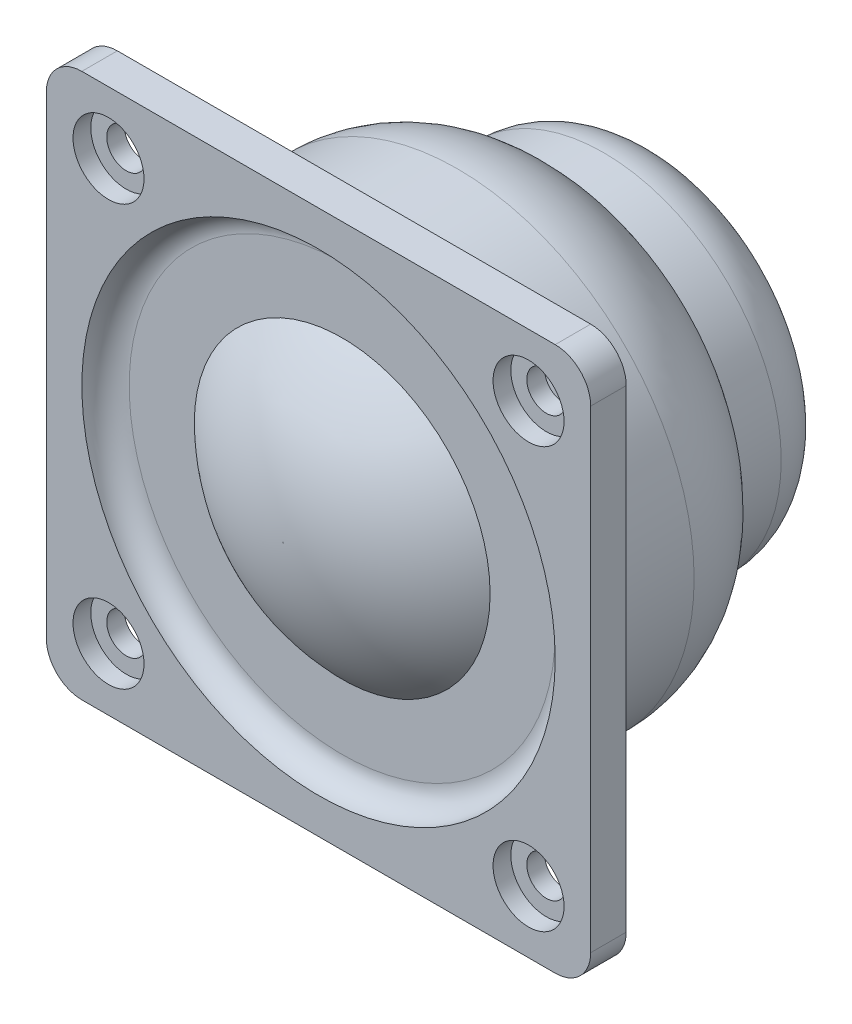
from build123d import *

# Parameters (mm, degrees)
ESQUISSE1_R             = 1.65
BOSS_EXTRU_1_DEPTH      = 3
ESQUISSE2_R             = 3
ENL_V_MAT_EXTRU_1_DEPTH = 1.5
ESQUISSE3_R             = 20
BOSS_EXTRU_2_DEPTH      = 17.4
ESQUISSE4_R             = 15
BOSS_EXTRU_3_DEPTH      = 8.7
CONG_1_R                = 10
CONG_2_R                = 5
ESQUISSE5_R             = 20
ENL_V_MAT_EXTRU_2_DEPTH = 2
ESQUISSE6_R             = 12.5
BOSS_EXTRU_4_DEPTH      = 5
CONG_3_R                = 18
CONG_4_R                = 2


# Some blends are built 0.0001 mm under size
with BuildPart() as part:
    # Esquisse1 → Boss.-Extru.1 (new body)
    with BuildSketch(Plane.XY):
        with BuildLine():
            Line((-20, 23), (20, 23))
            ThreePointArc((20, 23), (22.121320344, 22.121320344), (23, 20))
            Line((23, 20), (23, -20))
            ThreePointArc((23, -20), (22.121320344, -22.121320344), (20, -23))
            Line((20, -23), (-20, -23))
            ThreePointArc((-20, -23), (-22.121320344, -22.121320344), (-23, -20))
            Line((-23, -20), (-23, 20))
            ThreePointArc((-23, 20), (-22.121320344, 22.121320344), (-20, 23))
        make_face()
        with Locations((17.748380208, 17.748380208)):
            Circle(ESQUISSE1_R, mode=Mode.SUBTRACT)
        with Locations((-17.748380208, 17.748380208)):
            Circle(ESQUISSE1_R, mode=Mode.SUBTRACT)
        with Locations((17.748380208, -17.748380208)):
            Circle(ESQUISSE1_R, mode=Mode.SUBTRACT)
        with Locations((-17.748380208, -17.748380208)):
            Circle(ESQUISSE1_R, mode=Mode.SUBTRACT)
    extrude(amount=BOSS_EXTRU_1_DEPTH)

    # Esquisse2 → Enlèv. mat.-Extru.1 (cut)
    with BuildSketch(Plane.XY.offset(3)):
        with Locations((-17.748380208, 17.748380208)):
            Circle(ESQUISSE2_R)
        with Locations((17.748380208, 17.748380208)):
            Circle(ESQUISSE2_R)
        with Locations((17.748380208, -17.748380208)):
            Circle(ESQUISSE2_R)
        with Locations((-17.748380208, -17.748380208)):
            Circle(ESQUISSE2_R)
    extrude(amount=-ENL_V_MAT_EXTRU_1_DEPTH, mode=Mode.SUBTRACT)

    # Esquisse3 → Boss.-Extru.2 (add)
    with BuildSketch(Plane(origin=(0, 0, 0), x_dir=(-1, 0, 0), z_dir=(0, 0, -1))):
        with Locations(Location((0, 0, 0), (0, 0, 180))):
            Circle(ESQUISSE3_R)
    extrude(amount=BOSS_EXTRU_2_DEPTH)

    # Esquisse4 → Boss.-Extru.3 (add)
    with BuildSketch(Plane(origin=(0, 0, -17.4), x_dir=(-1, 0, 0), z_dir=(0, 0, -1))):
        Circle(ESQUISSE4_R)
    extrude(amount=BOSS_EXTRU_3_DEPTH)

    # Congé1
    # the kernel refuses this fillet: 10 mm, written as the material it takes off along each edge
    with BuildSketch(Plane(origin=(0, 0, -17.4), x_dir=(1, 0, 0), z_dir=(0, 1, 0))) as cong_1_piece_1_section:
        with BuildLine():
            CenterArc((10, -8.660254038), CONG_1_R, 0, 60)
            Line((15, 0), (15.1, 0.173205081))
            ThreePointArc((15.1, 0.173205081), (17.5, 0.2), (20, 0.2))
            Line((20, 0.2), (20.2, 0))
            Line((20.2, 0), (20.2, -8.660254038))
            Line((20.2, -8.660254038), (20, -8.660254038))
        make_face()
    cong_1_piece_1 = revolve(axis=Axis((0, 0, -17.4), (0, 0, -1)), mode=Mode.PRIVATE)
    cong_1_piece_1 = cong_1_piece_1 - Plane(origin=(0, 0, -13.800562686), x_dir=(-1, 0, 0), z_dir=(0, 0, 1)) * Cylinder(15, 81, mode=Mode.PRIVATE)
    add(cong_1_piece_1, mode=Mode.SUBTRACT)

    # Congé2
    cong_2_edges = [part.edges().sort_by_distance(p)[0] for p in [
        (15, 0, -26.1),
    ]]
    fillet(cong_2_edges, radius=CONG_2_R)

    # Esquisse5 → Enlèv. mat.-Extru.2 (cut)
    with BuildSketch(Plane.XY.offset(3)):
        Circle(ESQUISSE5_R)
    extrude(amount=-ENL_V_MAT_EXTRU_2_DEPTH, mode=Mode.SUBTRACT)

    # Esquisse6 → Boss.-Extru.4 (add)
    with BuildSketch(Plane.XY.offset(1)):
        Circle(ESQUISSE6_R)
    extrude(amount=BOSS_EXTRU_4_DEPTH)

    # Congé3
    # the kernel refuses this fillet: 18 mm, written as the material it takes off along each edge
    with BuildSketch(Plane(origin=(0, 0, 6), x_dir=(1, 0, 0), z_dir=(0, -1, 0))) as cong_3_piece_1:
        with BuildLine():
            CenterArc((0.050100402, -18), CONG_3_R, 46.238257307, 43.761742693)
            Line((0.050100402, 0), (0.050100402, 0.36))
            Line((0.050100402, 0.36), (12.5, 0.36))
            Line((12.5, 0.36), (12.86, 0))
            ThreePointArc((12.86, 0), (12.86, -2.5), (12.748997992, -4.74))
            Line((12.748997992, -4.74), (12.5, -5))
        make_face()
    revolve(axis=Axis((0, 0, 6), (0, 0, 1)), mode=Mode.SUBTRACT)

    # Congé4
    cong_4_edges = [part.edges().sort_by_distance(p)[0] for p in [
        (-20, 0, 1),
    ]]
    fillet(cong_4_edges, radius=CONG_4_R - 0.0001)  # a hair under: the kernel refuses the full size


solid = part.part
